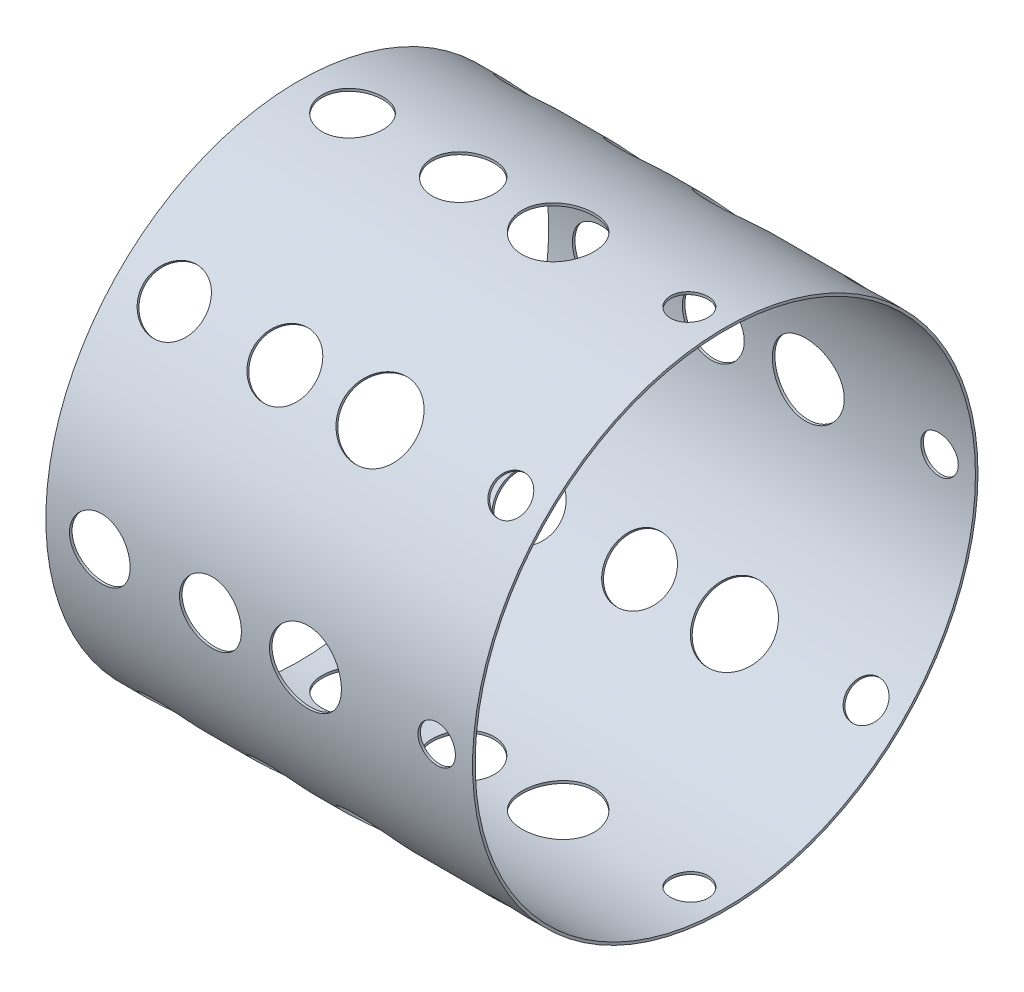
from build123d import *

# Parameters (mm, degrees)
SKETCH1_R           = 60.17006
SKETCH1_R_2         = 59.563
BOSS_EXTRUDE1_DEPTH = 101.6
SKETCH3_R           = 7.215780483
SKETCH3_R_2         = 7.364559462
SKETCH3_R_3         = 8.554791294
SKETCH3_R_4         = 4.463369371
CUT_EXTRUDE1_DEPTH  = 133.527100024
CIRPATTERN1_COUNT   = 8


with BuildPart() as part:
    # Sketch1 → Boss-Extrude1 (new body)
    with BuildSketch(Plane(origin=(0, 0, 0), x_dir=(0, 0, -1), z_dir=(1, 0, 0))):
        Circle(SKETCH1_R)
        Circle(SKETCH1_R_2, mode=Mode.SUBTRACT)
    extrude(amount=BOSS_EXTRUDE1_DEPTH)

    # Sketch3 → Cut-Extrude1 (cut, symmetric)
    with BuildSketch(Plane(origin=(0, 0, 0), x_dir=(1, 0, 0), z_dir=(0, 1, 0))):
        with Locations((12.855831637, 0)):
            Circle(SKETCH3_R)
        with Locations((39.189710925, 0)):
            Circle(SKETCH3_R_2)
        with Locations((61.804115737, 0)):
            Circle(SKETCH3_R_3)
        with Locations((93.047701333, 0)):
            Circle(SKETCH3_R_4)
    cut_extrude1 = extrude(amount=CUT_EXTRUDE1_DEPTH, both=True, mode=Mode.SUBTRACT)

    # CirPattern1: Cut-Extrude1 ×8 about axis
    cirpattern1_axis = Axis((4.646822769, 0, 0), (1, 0, 0))
    for i in range(1, CIRPATTERN1_COUNT):
        add(cut_extrude1.rotate(cirpattern1_axis, i * 360 / CIRPATTERN1_COUNT), mode=Mode.SUBTRACT)


solid = part.part
